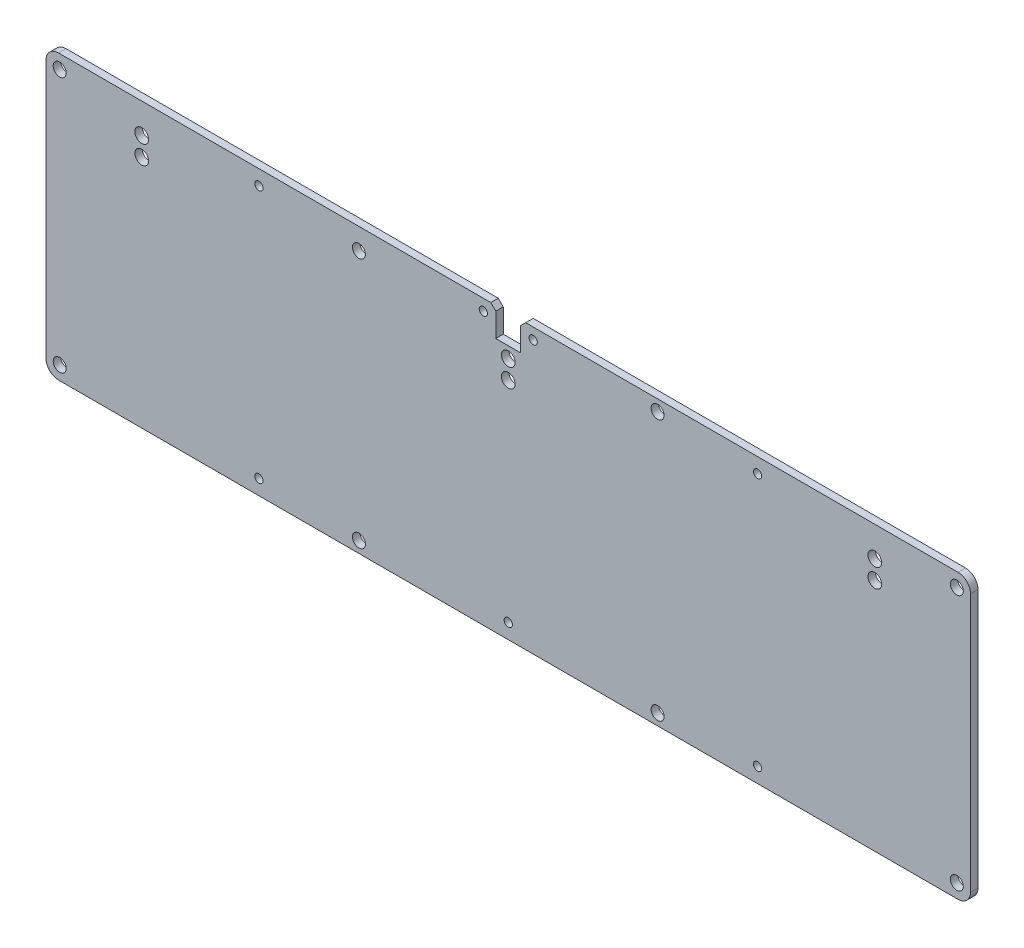
from build123d import *

# Parameters (mm, degrees)
MODEL_R             = 2.6
MODEL_R_2           = 1.65
MODEL_R_3           = 2.75
BOSS_EXTRUDE1_DEPTH = 3


with BuildPart() as part:
    # Model → Boss-Extrude1 (new body)
    with BuildSketch(Plane.XY):
        with BuildLine():
            Line((0, 108.6), (0, 5))
            ThreePointArc((0, 5), (1.464466094, 1.464466094), (5, 0))
            Line((5, 0), (365.775, 0))
            ThreePointArc((365.775, 0), (369.310533906, 1.464466094), (370.775, 5))
            Line((370.775, 5), (370.775, 108.6))
            ThreePointArc((370.775, 108.6), (369.310533906, 112.135533906), (365.775, 113.6))
            Line((365.775, 113.6), (192.387500002, 113.6))
            Line((192.387500002, 113.6), (190.387500002, 111.6))
            Line((190.387500002, 111.6), (190.387500002, 102.1))
            Line((190.387500002, 102.1), (180.387500002, 102.1))
            Line((180.387500002, 102.1), (180.387500001, 111.6))
            Line((180.387500001, 111.6), (178.387500002, 113.6))
            Line((178.387500002, 113.6), (5, 113.6))
            ThreePointArc((5, 113.6), (1.464466094, 112.135533906), (0, 108.6))
        make_face()
        with Locations((5.5, 108.1)):
            Circle(MODEL_R, mode=Mode.SUBTRACT)
        with Locations((5.5, 5.5)):
            Circle(MODEL_R, mode=Mode.SUBTRACT)
        with Locations((365.275, 5.5)):
            Circle(MODEL_R, mode=Mode.SUBTRACT)
        with Locations((365.275, 108.1)):
            Circle(MODEL_R, mode=Mode.SUBTRACT)
        with Locations((125.5, 4.5)):
            Circle(MODEL_R, mode=Mode.SUBTRACT)
        with Locations((195.3875, 109.1)):
            Circle(MODEL_R_2, mode=Mode.SUBTRACT)
        with Locations((175.3875, 109.1)):
            Circle(MODEL_R_2, mode=Mode.SUBTRACT)
        with Locations((38.387499996, 94.1)):
            Circle(MODEL_R_3, mode=Mode.SUBTRACT)
        with Locations((38.3875, 101.6)):
            Circle(MODEL_R_3, mode=Mode.SUBTRACT)
        with Locations((332.387499996, 94.1)):
            Circle(MODEL_R_3, mode=Mode.SUBTRACT)
        with Locations((332.3875, 101.6)):
            Circle(MODEL_R_3, mode=Mode.SUBTRACT)
        with Locations((185.387499995, 90.1)):
            Circle(MODEL_R_3, mode=Mode.SUBTRACT)
        with Locations((185.387499999, 97.6)):
            Circle(MODEL_R_3, mode=Mode.SUBTRACT)
        with Locations((85.3875, 107.6)):
            Circle(MODEL_R_2, mode=Mode.SUBTRACT)
        with Locations((285.3875, 107.6)):
            Circle(MODEL_R_2, mode=Mode.SUBTRACT)
        with Locations((85.3875, 6)):
            Circle(MODEL_R_2, mode=Mode.SUBTRACT)
        with Locations((185.3875, 6)):
            Circle(MODEL_R_2, mode=Mode.SUBTRACT)
        with Locations((285.3875, 6)):
            Circle(MODEL_R_2, mode=Mode.SUBTRACT)
        with Locations((245.275, 4.5)):
            Circle(MODEL_R, mode=Mode.SUBTRACT)
        with Locations((125.499999999, 105.1)):
            Circle(MODEL_R, mode=Mode.SUBTRACT)
        with Locations((245.275, 109.1)):
            Circle(MODEL_R, mode=Mode.SUBTRACT)
    extrude(amount=BOSS_EXTRUDE1_DEPTH)


solid = part.part
